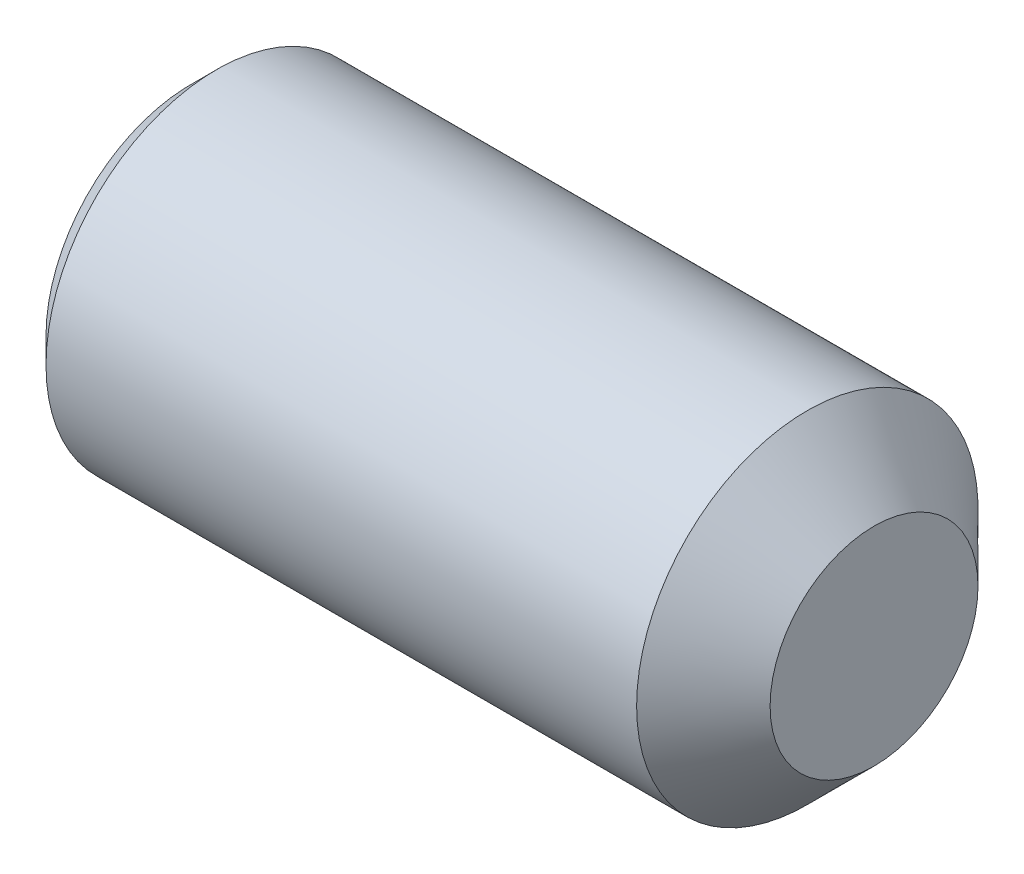
from build123d import *

# Parameters (mm, degrees)
HEX_2_DEPTH = 14.2748


with BuildPart() as part:
    # BodySke → BaseBody (revolve)
    with BuildSketch(Plane.XY):
        Polygon((0, 0), (0, 10.81024), (1.88976, 12.7), (45.8343, 12.7), (50.8, 7.7343), (50.8, 0), align=None)
    revolve(axis=Axis((-12.7, 0, 0), (1, 0, 0)))

    # Sketch2 → Hex 2 (cut)
    with BuildSketch(Plane.ZY):
        Polygon((4.120779811, 7.1374), (-4.120779811, 7.1374), (-8.241559623, 0), (-4.120779811, -7.1374), (4.120779811, -7.1374), (8.241559623, 0), align=None)
    extrude(amount=-HEX_2_DEPTH, mode=Mode.SUBTRACT)


solid = part.part
